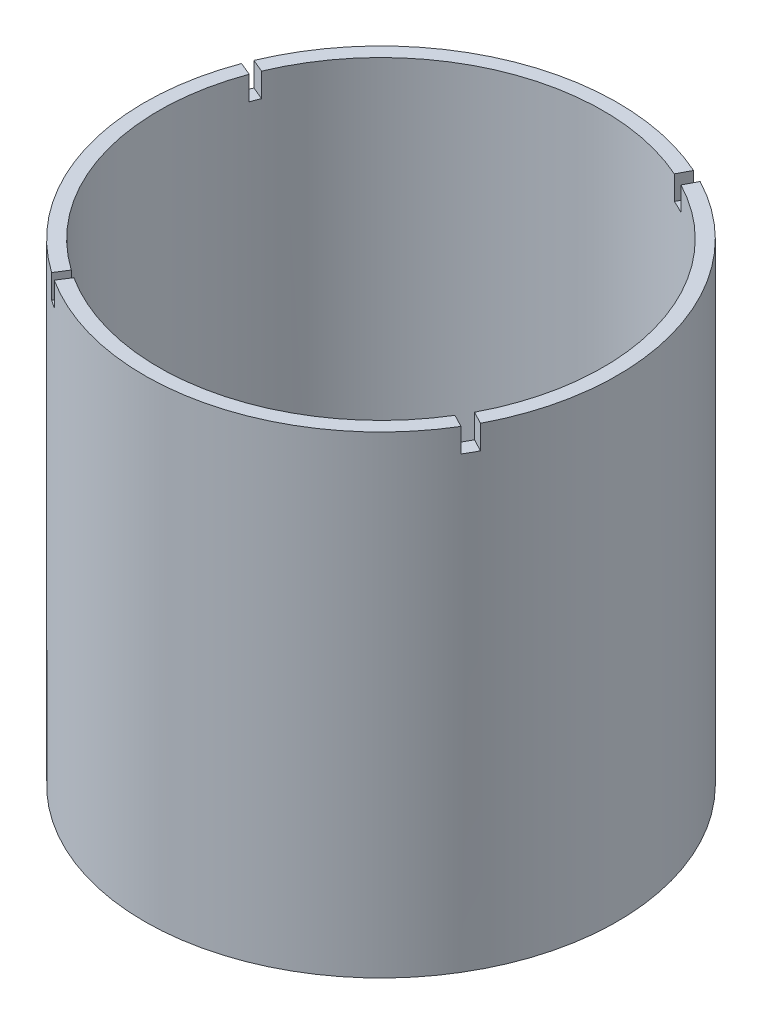
from build123d import *

# Parameters (mm, degrees)
SKETCH1_R           = 50
BOSS_EXTRUDE1_DEPTH = 100
SHELL1_T            = -3
CUT_EXTRUDE1_REACH  = 124.474
SKETCH2_R           = 15
BOSS_EXTRUDE2_DEPTH = 7
SKETCH4_R           = 2
CUT_EXTRUDE2_DEPTH  = 4
CUT_EXTRUDE3_DEPTH  = 3
FILLET1_R           = 5
CAVITY1_START       = 94.95
CAVITY1_DEPTH       = 5.05


# Read off the part's stored shape, not the designer's step: Cavity1
with BuildPart() as part:
    # Sketch1 → Boss-Extrude1 (new body)
    with BuildSketch(Plane(origin=(0, 0, 0), x_dir=(1, 0, 0), z_dir=(0, 1, 0))):
        with Locations(Location((0, 0, 0), (0, 0, 270))):
            Circle(SKETCH1_R)
    extrude(amount=BOSS_EXTRUDE1_DEPTH)

    # Shell1
    shell1_openings = [part.faces().sort_by_distance(p)[0] for p in [
        (0, 100, 0),
    ]]
    offset(amount=SHELL1_T, openings=shell1_openings, kind=Kind.INTERSECTION)

    # Sketch2 → Cut-Extrude1 (cut, up to next)
    with BuildSketch(Plane.XZ, mode=Mode.PRIVATE) as cut_extrude1_sk1:
        with Locations(Location((0, 0, 0), (0, 0, 270))):
            Circle(SKETCH2_R)
    cut_extrude1_tool1 = extrude(cut_extrude1_sk1.sketch, amount=-CUT_EXTRUDE1_REACH, mode=Mode.PRIVATE) & part.part
    add(cut_extrude1_tool1.solids().sort_by_distance((0, 0, 0))[0], mode=Mode.SUBTRACT)

    # Sketch3 → Boss-Extrude2 (add)
    with BuildSketch(Plane.XZ):
        with BuildLine():
            Line((11.656771923, 10.505696947), (15.97605159, 3.771914714))
            ThreePointArc((15.97605159, 3.771914714), (17.208044811, -5.36712002), (10.999048015, -12.185339871))
            Line((10.999048015, -12.185339871), (3.617532023, -15.269690962))
            ThreePointArc((3.617532023, -15.269690962), (-1.003618951, -21.145948661), (6.356204016, -19.835053254))
            ThreePointArc((6.356204016, -19.835053254), (24.343421913, -7.592615462), (16.505212694, 12.704669259))
            ThreePointArc((16.505212694, 12.704669259), (11.195588228, 17.967114404), (11.656771923, 10.505696947))
        make_face()
    extrude(amount=BOSS_EXTRUDE2_DEPTH)

    # Sketch4 → Cut-Extrude2 (cut)
    with BuildSketch(Plane.XZ.offset(7)):
        with Locations(Location((12.847770427, 14.324272933, 0), (0, 0, 270))):
            Circle(SKETCH4_R)
        with Locations(Location((2.426533519, -19.088266948, 0), (0, 0, 270))):
            Circle(SKETCH4_R)
    extrude(amount=-CUT_EXTRUDE2_DEPTH, mode=Mode.SUBTRACT)

    # Sketch5 → Cut-Extrude3 (cut)
    with BuildSketch(Plane.XZ):
        with BuildLine():
            Line((-28.03113406, -8.017376473), (-18.503146029, 22.531231418))
            Line((-18.503146029, 22.531231418), (-33.777449975, 27.295225433))
            ThreePointArc((-33.777449975, 27.295225433), (-44.86826784, 13.99423242), (-43.305438005, -3.253382458))
            Line((-43.305438005, -3.253382458), (-28.03113406, -8.017376473))
        make_face()
    extrude(amount=-CUT_EXTRUDE3_DEPTH, mode=Mode.SUBTRACT)

    # Fillet1
    fillet1_edges = [part.edges().sort_by_distance(p)[0] for p in [
        (-33.777449975, 1.5, 27.295225433),
        (-18.503146029, 1.5, 22.531231418),
        (-28.03113406, 1.5, -8.017376473),
        (-43.305438005, 1.5, -3.253382458),
    ]]
    fillet(fillet1_edges, radius=FILLET1_R)

    # Cavity1 outline → Cavity1 (cut)
    with BuildSketch(Plane(origin=(0, 0, 0), x_dir=(1, 0, 0), z_dir=(0, 1, 0)).offset(CAVITY1_START)):
        with BuildLine():
            ThreePointArc((19.102530443, 42.942907804), (20.477537397, 42.30449695), (21.831239809, 41.622073091))
            Line((21.831239809, 41.622073091), (23.224723201, 44.278801161))
            ThreePointArc((23.224723201, 44.278801161), (21.871785206, 44.962484495), (20.498743854, 45.604840756))
            Line((20.498743854, 45.604840756), (19.102530443, 42.942907804))
        make_face()
        with BuildLine():
            Line((44.278801161, -23.224723201), (41.622073091, -21.831239809))
            ThreePointArc((41.622073091, -21.831239809), (40.896346213, -23.162229305), (40.128071352, -24.469121144))
            Line((40.128071352, -24.469121144), (42.790004304, -25.865334555))
            ThreePointArc((42.790004304, -25.865334555), (43.55441916, -24.556314293), (44.278801161, -23.224723201))
        make_face()
        with BuildLine():
            ThreePointArc((-44.105134018, 16.239986245), (-43.745876837, 17.184244522), (-43.366406458, 18.120562655))
            Line((-43.366406458, 18.120562655), (-46.134474955, 19.277194314))
            ThreePointArc((-46.134474955, 19.277194314), (-46.514536622, 18.341152714), (-46.875608808, 17.397623369))
            Line((-46.875608808, 17.397623369), (-44.105134018, 16.239986245))
        make_face()
        with BuildLine():
            Line((-26.99549792, -42.086138954), (-25.375768045, -39.560970617))
            ThreePointArc((-25.375768045, -39.560970617), (-26.220241948, -39.006395786), (-27.052600539, -38.43379768))
            Line((-27.052600539, -38.43379768), (-28.673738451, -40.961161156))
            ThreePointArc((-28.673738451, -40.961161156), (-27.840301063, -41.532127765), (-26.99549792, -42.086138954))
        make_face()
    extrude(amount=CAVITY1_DEPTH, mode=Mode.SUBTRACT)


solid = part.part
